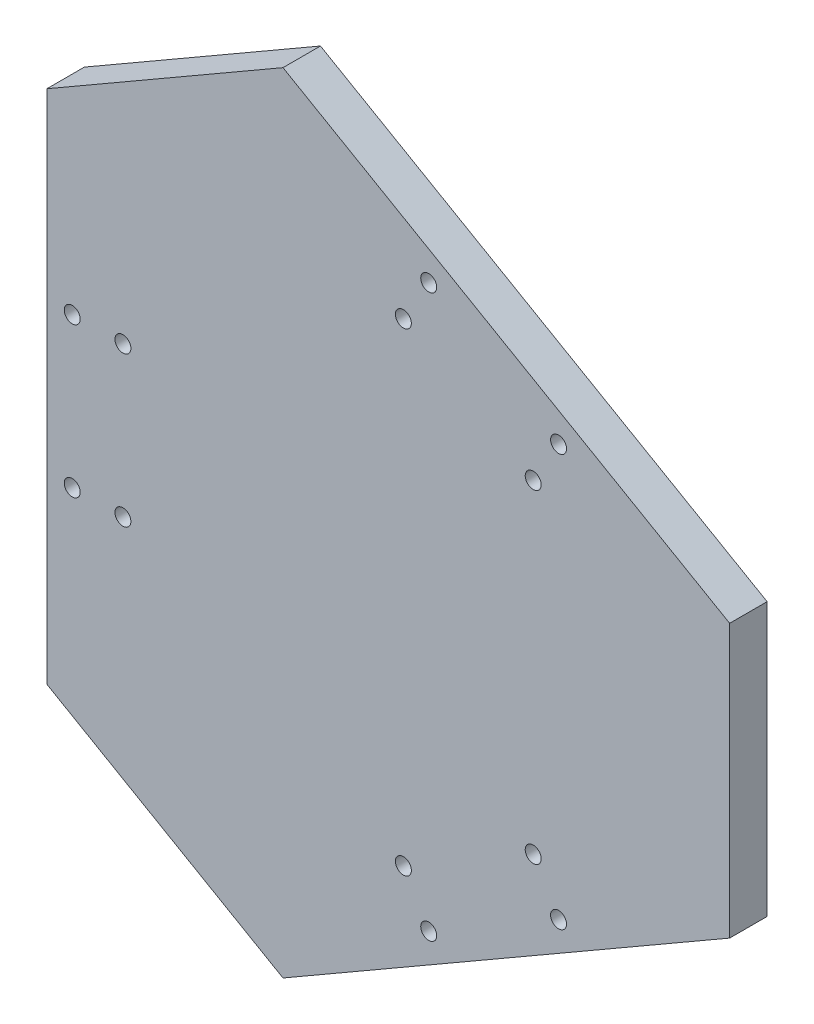
from build123d import *

# Parameters (mm, degrees)
BOSS_EXTRUDE1_DEPTH             = 6.35
TAP_DRILL_FOR_1_4_28_TAP1_D     = 5.4102
TAP_DRILL_FOR_1_4_28_TAP1_DEPTH = 12.7
TAP_DRILL_FOR_1_4_28_TAP1_TIP   = 1.625388061


with BuildPart() as part:
    # Sketch1 → Boss-Extrude1 (new, symmetric)
    with BuildSketch(Plane(origin=(0, 0, 0), x_dir=(0, 1, 0), z_dir=(0, 0, 1))):
        Polygon((-133.562982174, 23.779290378), (-87.374960639, 103.779290378), (87.374960639, 103.779290378), (133.562982174, 23.779290378), (46.188021535, -127.558580757), (-46.188021535, -127.558580757), align=None)
    extrude(amount=BOSS_EXTRUDE1_DEPTH, both=True)

    # Tap Drill for 1/4-28 Tap1
    with Locations(Plane.XY.offset(6.35)):
        with Locations((17.010037433, -80.262249073), (25.598412433, -95.137750927), (69.592502945, -69.737750927), (61.004127945, -54.862249073), (61.004127945, 54.862249073), (69.592502945, 69.737750927), (25.598412433, 95.137750927), (17.010037433, 80.262249073), (-78.014165378, 25.4), (-95.190915378, 25.4), (-95.190915378, -25.4), (-78.014165378, -25.4)):
            Hole(TAP_DRILL_FOR_1_4_28_TAP1_D / 2, depth=TAP_DRILL_FOR_1_4_28_TAP1_DEPTH)
            with Locations((0, 0, -(TAP_DRILL_FOR_1_4_28_TAP1_DEPTH + TAP_DRILL_FOR_1_4_28_TAP1_TIP / 2))):  # 118° drill point
                Cone(0, TAP_DRILL_FOR_1_4_28_TAP1_D / 2, TAP_DRILL_FOR_1_4_28_TAP1_TIP, mode=Mode.SUBTRACT)


solid = part.part
